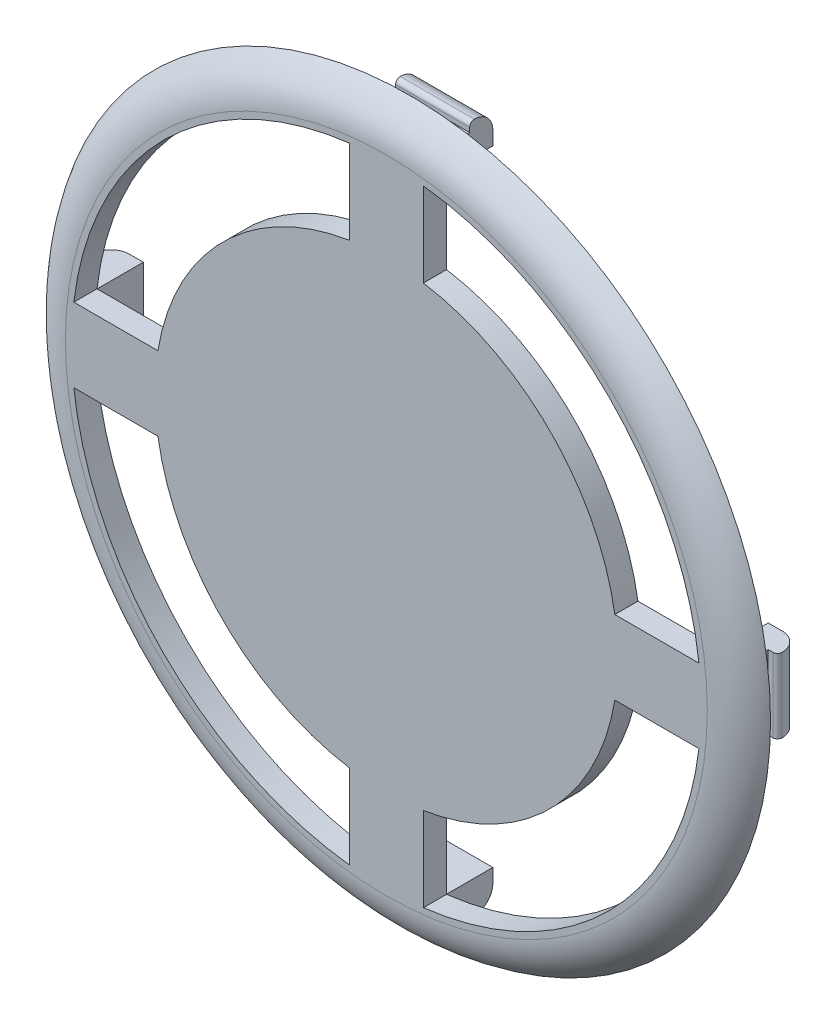
from build123d import *

# Parameters (mm, degrees)
SKETCH_1_R                       = 39
EXTRUDE_1_DEPTH                  = 2.5
FILLET_1_R                       = 5
SKETCH_2_W                       = 8
SKETCH_2_H                       = 2.5
EXTRUDE_2_DEPTH                  = 5
SKETCH_3_W                       = 8
SKETCH_3_H                       = 2.5
EXTRUDE_3_DEPTH                  = 1
FILLET_4_R                       = 0.5
FILLET_5_R                       = 2
PATTERN_CIRCULAR_7_COUNT         = 4
FILLET_4_OF_PATTERN_CIRCULAR_7_R = 0.5
FILLET_5_OF_PATTERN_CIRCULAR_7_R = 2
CUT_EXTRUDE_1_DEPTH              = 56.380501984
PATTERN_CIRCULAR_8_COUNT         = 4


# Some blends are built 0.0001 mm under size
with BuildPart() as part:
    # ｽｹｯﾁ1 → ﾎﾞｽ - 押し出し1 (new body)
    with BuildSketch(Plane.XY):
        Circle(SKETCH_1_R)
    extrude(amount=EXTRUDE_1_DEPTH)

    # ﾌｨﾚｯﾄ1
    # the kernel refuses this fillet: 5 mm, written as the material it takes off along each edge
    with BuildSketch(Plane(origin=(0, 0, 2.5), x_dir=(1, 0, 0), z_dir=(0, -1, 0))) as fillet_1_piece_1:
        with BuildLine():
            CenterArc((34.669872981, -5), FILLET_1_R, 30, 60)
            Line((34.669872981, 0), (34.669872981, 0.1))
            Line((34.669872981, 0.1), (39, 0.1))
            Line((39, 0.1), (39.1, 0))
            ThreePointArc((39.1, 0), (39.1, -1.25), (39.08660254, -2.45))
            Line((39.08660254, -2.45), (39, -2.5))
        make_face()
    revolve(axis=Axis((0, 0, 2.5), (0, 0, 1)), mode=Mode.SUBTRACT)

    # ｽｹｯﾁ2 → ﾎﾞｽ - 押し出し2 (add)
    with BuildSketch(Plane(origin=(0, 0, 0), x_dir=(-1, 0, 0), z_dir=(0, 0, -1))):
        with Locations((0, 35)):
            Rectangle(SKETCH_2_W, SKETCH_2_H)
    extrude_2 = extrude(amount=EXTRUDE_2_DEPTH)

    # ｽｹｯﾁ3 → ﾎﾞｽ - 押し出し3 (add)
    with BuildSketch(Plane(origin=(0, 36.25, 0), x_dir=(1, 0, 0), z_dir=(0, 1, 0))):
        with Locations((0, 3.75)):
            Rectangle(SKETCH_3_W, SKETCH_3_H)
    extrude_3 = extrude(amount=EXTRUDE_3_DEPTH)

    # ﾌｨﾚｯﾄ4
    fillet_4_edges = [part.edges().sort_by_distance(p)[0] for p in [
        (0, 37.25, -2.5),
    ]]
    fillet(fillet_4_edges, radius=FILLET_4_R)

    # ﾌｨﾚｯﾄ5
    fillet_5_edges = [part.edges().sort_by_distance(p)[0] for p in [
        (0, 37.25, -5),
    ]]
    fillet(fillet_5_edges, radius=FILLET_5_R - 0.0001)  # a hair under: the kernel refuses the full size

    # 円形ﾊﾟﾀｰﾝ7: ﾎﾞｽ - 押し出し2, ﾎﾞｽ - 押し出し3 ×4 about axis
    pattern_circular_7_axis = Axis((0, 0, 0), (0, 0, 1))
    add([extrude_2.rotate(pattern_circular_7_axis, i * 360 / PATTERN_CIRCULAR_7_COUNT) for i in range(1, PATTERN_CIRCULAR_7_COUNT)])
    add([extrude_3.rotate(pattern_circular_7_axis, i * 360 / PATTERN_CIRCULAR_7_COUNT) for i in range(1, PATTERN_CIRCULAR_7_COUNT)])

    # ﾌｨﾚｯﾄ4 of 円形ﾊﾟﾀｰﾝ7
    fillet_4_of_pattern_circular_7_edges = [part.edges().sort_by_distance(p)[0] for p in [
        (-37.25, 0, -2.5),
        (0, -37.25, -2.5),
        (37.25, 0, -2.5),
    ]]
    fillet(fillet_4_of_pattern_circular_7_edges, radius=FILLET_4_OF_PATTERN_CIRCULAR_7_R)

    # ﾌｨﾚｯﾄ5 of 円形ﾊﾟﾀｰﾝ7
    fillet_5_of_pattern_circular_7_edges = [part.edges().sort_by_distance(p)[0] for p in [
        (-37.25, 0, -5),
        (0, -37.25, -5),
        (37.25, 0, -5),
    ]]
    fillet(fillet_5_of_pattern_circular_7_edges, radius=FILLET_5_OF_PATTERN_CIRCULAR_7_R - 0.0001)  # a hair under: the kernel refuses the full size

    # ｽｹｯﾁ7 → ｶｯﾄ - 押し出し1 (cut, through all)
    with BuildSketch(Plane(origin=(0, 0, 0), x_dir=(-1, 0, 0), z_dir=(0, 0, -1))):
        with BuildLine():
            Line((24.677925359, 4), (33.763886032, 4))
            ThreePointArc((33.763886032, 4), (24.04163056, 24.04163056), (4, 33.763886032))
            Line((4, 33.763886032), (4, 24.677925359))
            ThreePointArc((4, 24.677925359), (17.67766953, 17.67766953), (24.677925359, 4))
        make_face()
    cut_extrude_1 = extrude(amount=-CUT_EXTRUDE_1_DEPTH, mode=Mode.SUBTRACT)

    # 円形ﾊﾟﾀｰﾝ8: ｶｯﾄ - 押し出し1 ×4 about axis
    pattern_circular_8_axis = Axis((0, 0, 0), (0, 0, -1))
    for i in range(1, PATTERN_CIRCULAR_8_COUNT):
        add(cut_extrude_1.rotate(pattern_circular_8_axis, i * 360 / PATTERN_CIRCULAR_8_COUNT), mode=Mode.SUBTRACT)


solid = part.part
